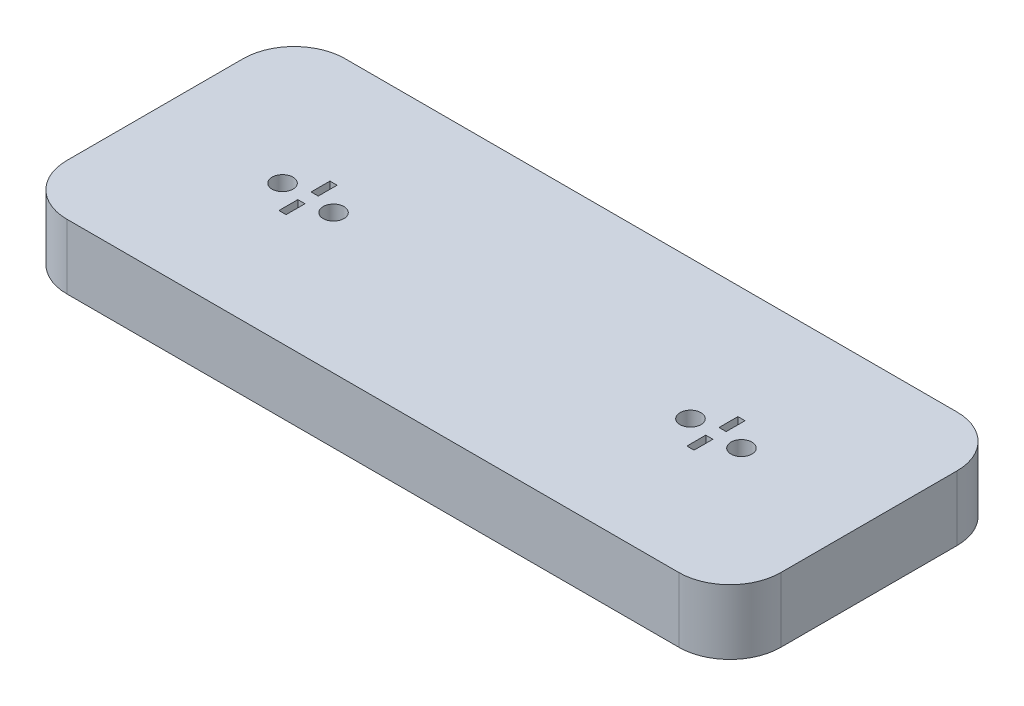
from build123d import *

# Parameters (mm, degrees)
BOSS_EXTRUDE1_DEPTH = 6.35
SKETCH2_R           = 1.025
SKETCH2_W           = 0.7
SKETCH2_H           = 1.85
CUT_EXTRUDE1_DEPTH  = 6.35


with BuildPart() as part:
    # Sketch1 → Boss-Extrude1 (new body)
    with BuildSketch(Plane(origin=(0, 0, 0), x_dir=(1, 0, 0), z_dir=(0, 1, 0))):
        with BuildLine():
            Line((5, 0), (65, 0))
            ThreePointArc((65, 0), (68.535533906, 1.464466094), (70, 5))
            Line((70, 5), (70, 22.27))
            ThreePointArc((70, 22.27), (68.535533906, 25.805533906), (65, 27.27))
            Line((65, 27.27), (5, 27.27))
            ThreePointArc((5, 27.27), (1.464466094, 25.805533906), (0, 22.27))
            Line((0, 22.27), (0, 5))
            ThreePointArc((0, 5), (1.464466094, 1.464466094), (5, 0))
        make_face()
    extrude(amount=BOSS_EXTRUDE1_DEPTH)

    # Sketch2 → Cut-Extrude1 (cut)
    with BuildSketch(Plane(origin=(0, 6.35, 0), x_dir=(1, 0, 0), z_dir=(0, 1, 0))):
        with Locations((12.5, 13.635)):
            Circle(SKETCH2_R)
        with Locations((17.5, 13.635)):
            Circle(SKETCH2_R)
        with Locations((52.5, 13.635)):
            Circle(SKETCH2_R)
        with Locations((57.5, 13.635)):
            Circle(SKETCH2_R)
        with Locations((15, 15.21)):
            Rectangle(SKETCH2_W, SKETCH2_H)
        with Locations((15, 12.06)):
            Rectangle(SKETCH2_W, SKETCH2_H)
        with Locations((55, 12.06)):
            Rectangle(SKETCH2_W, SKETCH2_H)
        with Locations((55, 15.21)):
            Rectangle(SKETCH2_W, SKETCH2_H)
    extrude(amount=-CUT_EXTRUDE1_DEPTH, mode=Mode.SUBTRACT)


solid = part.part
